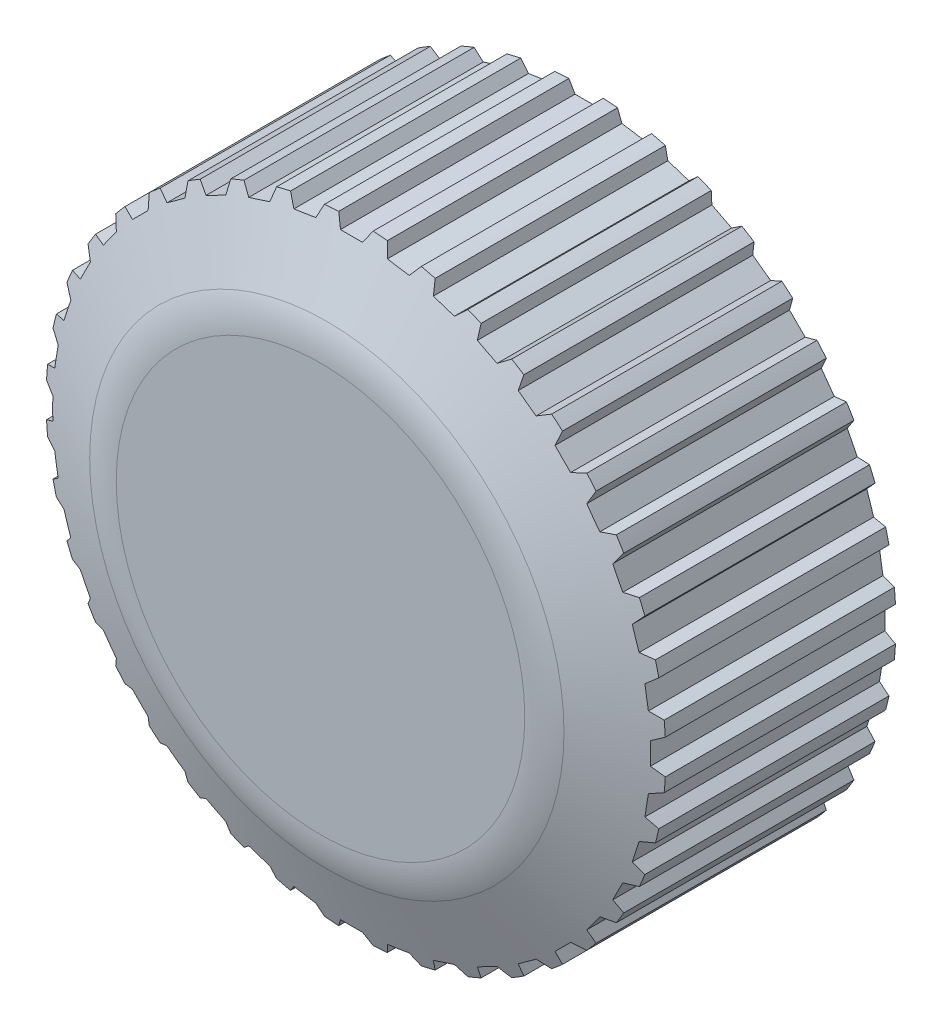
from build123d import *

# Parameters (mm, degrees)
ESQUISSE1_R                  = 14
BOSS_EXTRU_1_DEPTH           = 12
ENL_V_MAT_EXTRU_1_DEPTH      = 24.151673806
R_P_TITION_CIRCULAIRE1_COUNT = 40
CONG_1_R                     = 4
ESQUISSE6_R                  = 4
ENL_V_MAT_EXTRU_2_DEPTH      = 6


with BuildPart() as part:
    # Esquisse1 → Boss.-Extru.1 (new body)
    with BuildSketch(Plane.XY):
        Circle(ESQUISSE1_R)
    extrude(amount=BOSS_EXTRU_1_DEPTH)

    # Esquisse2 → Enlèv. mat.-Extru.1 (cut, through all)
    with BuildSketch(Plane.XY.offset(12)):
        Polygon((-1.654700538, 15.5), (-0.5, 13.5), (0.5, 13.5), (1.654700538, 15.5), align=None)
    enl_v_mat_extru_1 = extrude(amount=-ENL_V_MAT_EXTRU_1_DEPTH, mode=Mode.SUBTRACT)

    # Répétition circulaire1: Enlèv. mat.-Extru.1 ×40 about axis
    r_p_tition_circulaire1_axis = Axis((0, 0, 12), (0, 0, -1))
    for i in range(1, R_P_TITION_CIRCULAIRE1_COUNT):
        add(enl_v_mat_extru_1.rotate(r_p_tition_circulaire1_axis, i * 360 / R_P_TITION_CIRCULAIRE1_COUNT), mode=Mode.SUBTRACT)

    # Esquisse5 → Enlèvement de matière-Révolution1 (revolve, cut)
    with BuildSketch(Plane(origin=(0, 0, 0), x_dir=(1, 0, 0), z_dir=(0, 1, 0))):
        Polygon((10, -12), (14, -10.4), (14, -12), align=None)
    revolve(axis=Axis((0, 0, 18.097465992), (0, 0, -1)), mode=Mode.SUBTRACT)

    # Congé1
    cong_1_edges = [part.edges().sort_by_distance(p)[0] for p in [
        (-10, 0, 12),
    ]]
    fillet(cong_1_edges, radius=CONG_1_R)

    # Esquisse6 → Enlèv. mat.-Extru.2 (cut)
    with BuildSketch(Plane(origin=(0, 0, 0), x_dir=(-1, 0, 0), z_dir=(0, 0, -1))):
        Circle(ESQUISSE6_R)
    extrude(amount=-ENL_V_MAT_EXTRU_2_DEPTH, mode=Mode.SUBTRACT)


solid = part.part
